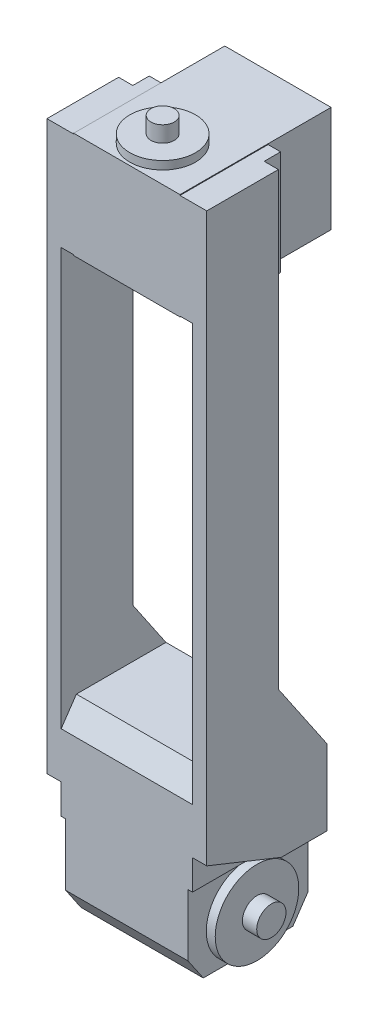
from build123d import *
from OCP.BRepFilletAPI import BRepFilletAPI_MakeChamfer

# Parameters (mm, degrees)
SKETCH1_W           = 41
SKETCH1_H           = 40.2
BOSS_EXTRUDE1_DEPTH = 61.1
SKETCH2_R           = 14
BOSS_EXTRUDE2_DEPTH = 3
SKETCH3_R           = 4.9
BOSS_EXTRUDE3_DEPTH = 4.8
CHAMFER1_SIZE       = 7.5
CHAMFER1_SIZE2      = 5.1
MIRROR5_START       = -20.5
MIRROR5_DEPTH       = 41
BOSS_EXTRUDE4_DEPTH = 1.5
BOSS_EXTRUDE5_DEPTH = 4.7625
SKETCH7_W           = 35.6
SKETCH7_H           = 50.6
BOSS_EXTRUDE6_DEPTH = 35.5
SKETCH9_W           = 29.5
SKETCH9_H           = 35
BOSS_EXTRUDE7_DEPTH = 39.8
SKETCH10_R          = 11
BOSS_EXTRUDE8_DEPTH = 2.75
SKETCH11_R          = 3.9
BOSS_EXTRUDE9_DEPTH = 5.35


# Read off the part's stored shape, not the designer's step: Mirror5
with BuildPart() as part:
    # Sketch1 → Boss-Extrude1 (new body)
    with BuildSketch(Plane(origin=(0, -13, 0), x_dir=(-1, 0, 0), z_dir=(0, 1, 0))):
        Rectangle(SKETCH1_W, SKETCH1_H)
    extrude(amount=BOSS_EXTRUDE1_DEPTH)

    # Sketch2 → Boss-Extrude2 (add)
    with BuildSketch(Plane.ZY.offset(20.5)):
        with Locations(Location((0, 0, 0), (0, 0, 248.213210702))):
            Circle(SKETCH2_R)
    boss_extrude2 = extrude(amount=BOSS_EXTRUDE2_DEPTH)

    # Sketch3 → Boss-Extrude3 (add)
    with BuildSketch(Plane.ZY.offset(23.5)):
        Circle(SKETCH3_R)
    boss_extrude3 = extrude(amount=BOSS_EXTRUDE3_DEPTH)

    # Chamfer1: one chamfer whose edges measure the first distance from different faces: ONE call of the kernel's chamfer builder (chamfer() names one face for all edges)
    chamfer1_edges_1 = [part.edges().sort_by_distance(p)[0] for p in [
        (0, 48.1, -20.1),
    ]]
    chamfer1_side_1 = [part.faces().sort_by_distance(p)[0] for p in [
        (0, 17.55, -20.1),
    ]]
    chamfer1_edges_2 = [part.edges().sort_by_distance(p)[0] for p in [
        (0, 48.1, 20.1),
    ]]
    chamfer1_side_2 = [part.faces().sort_by_distance(p)[0] for p in [
        (0, 17.55, 20.1),
    ]]
    chamfer1 = BRepFilletAPI_MakeChamfer(part.part.solid().wrapped)
    for e in chamfer1_edges_1:
        chamfer1.Add(CHAMFER1_SIZE, CHAMFER1_SIZE2, e.wrapped, chamfer1_side_1[0].wrapped)  # the first distance lies on this face
    for e in chamfer1_edges_2:
        chamfer1.Add(CHAMFER1_SIZE, CHAMFER1_SIZE2, e.wrapped, chamfer1_side_2[0].wrapped)  # the first distance lies on this face
    add(Compound.cast(chamfer1.Shape()), mode=Mode.REPLACE)

    # Mirror5 outline → Mirror5 (cut)
    with BuildSketch(Plane.YZ.offset(MIRROR5_START)):
        Polygon((-13, 20.1), (-13, 15), (-5.5, 20.1), align=None)
        Polygon((-5.5, -20.1), (-13, -15), (-13, -20.1), align=None)
    extrude(amount=MIRROR5_DEPTH, mode=Mode.SUBTRACT)

    # Sketch4 → Boss-Extrude4 (add)
    with BuildSketch(Plane.ZY.offset(20.5)):
        Polygon((-20.1, 15.2), (20.1, 15.2), (20.1, 40.6), (15, 48.1), (-15, 48.1), (-20.1, 40.6), align=None)
    boss_extrude4 = extrude(amount=BOSS_EXTRUDE4_DEPTH)

    # Mirror1: Boss-Extrude2, Boss-Extrude3, Boss-Extrude4 across plane
    add(boss_extrude2.mirror(Plane(origin=(0, 0, 0), x_dir=(0, 0, 1), z_dir=(1, 0, 0))))
    add(boss_extrude3.mirror(Plane(origin=(0, 0, 0), x_dir=(0, 0, 1), z_dir=(1, 0, 0))))
    add(boss_extrude4.mirror(Plane(origin=(0, 0, 0), x_dir=(0, 0, 1), z_dir=(1, 0, 0))))

    # Sketch6 → Boss-Extrude5 (add)
    with BuildSketch(Plane(origin=(22, 0, 0), x_dir=(0, 0, -1), z_dir=(1, 0, 0))):
        Polygon((20.1, 15.2), (20.1, 40.6), (3.9, 64.423529412), (3.9, 215.2), (-20.1, 215.2), (-20.1, 25.2), (4.9, 15.2), align=None)
    boss_extrude5 = extrude(amount=BOSS_EXTRUDE5_DEPTH)

    # Mirror2: Boss-Extrude5 across plane
    add(boss_extrude5.mirror(Plane(origin=(0, 0, 0), x_dir=(0, 0, 1), z_dir=(1, 0, 0))))



with BuildPart() as body_2:
    # Sketch7 → Boss-Extrude6 (new body)
    with BuildSketch(Plane(origin=(0, 215.45, 0), x_dir=(-1, 0, 0), z_dir=(0, 1, 0))):
        with Locations((0, -5.2)):
            Rectangle(SKETCH7_W, SKETCH7_H)
    extrude(amount=-BOSS_EXTRUDE6_DEPTH)


with BuildPart() as part_1:
    add(part.part)

    add(body_2.part)  # Boss-Extrude7 merges body 2
    # Sketch9 → Boss-Extrude7 (add)
    with BuildSketch(Plane.ZY.offset(-22)):
        with Locations((5.35, 197.7)):
            Rectangle(SKETCH9_W, SKETCH9_H)
    boss_extrude7 = extrude(amount=BOSS_EXTRUDE7_DEPTH)

    # Mirror3: Boss-Extrude7 across plane
    add(boss_extrude7.mirror(Plane(origin=(0, 0, 0), x_dir=(0, 0, 1), z_dir=(1, 0, 0))))

    # Sketch10 → Boss-Extrude8 (add)
    with BuildSketch(Plane(origin=(0, 215.45, 0), x_dir=(-1, 0, 0), z_dir=(0, 1, 0))):
        with Locations(Location((0, 8.1, 0), (0, 0, 270))):
            Circle(SKETCH10_R)
    extrude(amount=BOSS_EXTRUDE8_DEPTH)

    # Sketch11 → Boss-Extrude9 (add)
    with BuildSketch(Plane(origin=(0, 218.2, 0), x_dir=(-1, 0, 0), z_dir=(0, 1, 0))):
        with Locations(Location((0, 8.1, 0), (0, 0, 90))):
            Circle(SKETCH11_R)
    extrude(amount=BOSS_EXTRUDE9_DEPTH)


solid = part_1.part
